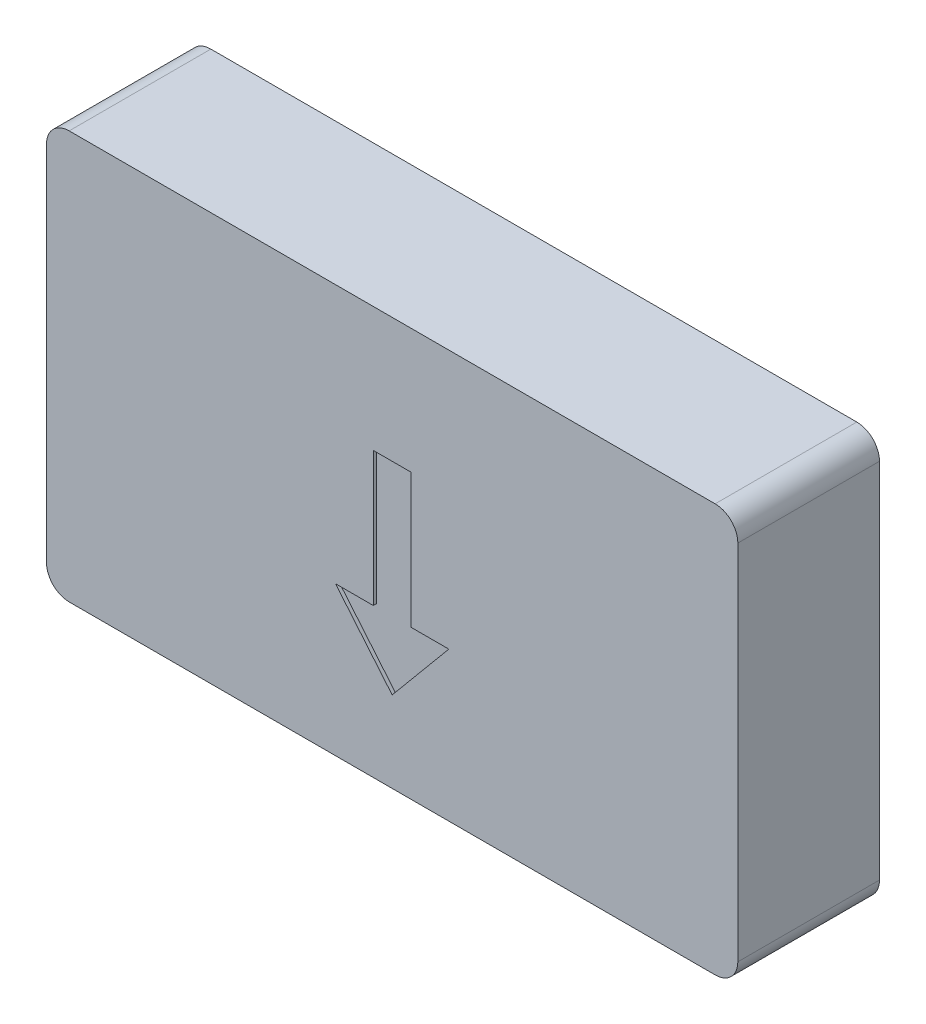
from build123d import *

# Parameters (mm, degrees)
SKETCH1_W           = 15.494
SKETCH1_H           = 9.144
BOSS_EXTRUDE1_DEPTH = 1.5875
FILLET1_R           = 0.508
WRAP2_START         = -0.0762
WRAP2_DEPTH         = 0.0762


# Read off the part's stored shape, not the designer's step: Wrap2
with BuildPart() as part:
    # Sketch1 → Boss-Extrude1 (new, symmetric)
    with BuildSketch(Plane.XY):
        with Locations((-92.71, -99.949)):
            Rectangle(SKETCH1_W, SKETCH1_H)
    extrude(amount=BOSS_EXTRUDE1_DEPTH, both=True)

    # Fillet1
    fillet1_edges = [part.edges().sort_by_distance(p)[0] for p in [
        (-84.963, -104.521, 0),
        (-100.457, -104.521, 0),
        (-100.457, -95.377, 0),
        (-84.963, -95.377, 0),
    ]]
    fillet(fillet1_edges, radius=FILLET1_R)

    # Wrap2 outline → Wrap2 (cut)
    with BuildSketch(Plane.XY.offset(1.5875).offset(WRAP2_START)):
        Polygon((-92.286666667, -98.171), (-93.133333333, -98.171), (-93.133333333, -101.181834934), (-93.98, -101.181834934), (-92.71, -102.705834934), (-91.44, -101.181834934), (-92.286666667, -101.181834934), align=None)
    extrude(amount=WRAP2_DEPTH, mode=Mode.SUBTRACT)


solid = part.part
